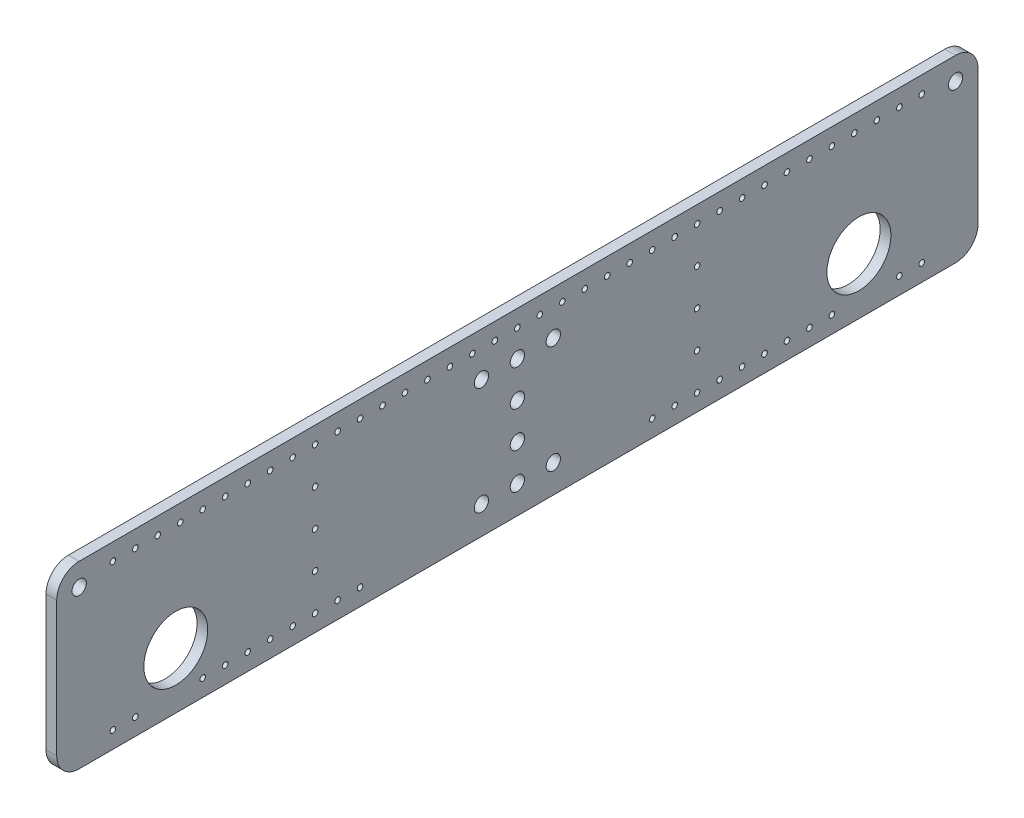
from build123d import *

# Parameters (mm, degrees)
SKETCH2_R           = 14.225
SKETCH2_R_2         = 3.18
SKETCH2_R_3         = 1.25
BOSS_EXTRUDE1_DEPTH = 4.7625


with BuildPart() as part:
    # Sketch2 → Boss-Extrude1 (new body)
    with BuildSketch(Plane(origin=(0, 0, 0), x_dir=(0, 0, -1), z_dir=(1, 0, 0))):
        with BuildLine():
            Line((-23.472321429, 28.668303571), (-23.472321429, -31.331696429))
            ThreePointArc((-23.472321429, -31.331696429), (-20.54338924, -38.40276424), (-13.472321429, -41.331696429))
            Line((-13.472321429, -41.331696429), (376.527678571, -41.331696429))
            ThreePointArc((376.527678571, -41.331696429), (383.598746383, -38.40276424), (386.527678571, -31.331696429))
            Line((386.527678571, -31.331696429), (386.527678571, 28.668303571))
            ThreePointArc((386.527678571, 28.668303571), (383.598746383, 35.739371383), (376.527678571, 38.668303571))
            Line((376.527678571, 38.668303571), (-13.472321429, 38.668303571))
            ThreePointArc((-13.472321429, 38.668303571), (-20.54338924, 35.739371383), (-23.472321429, 28.668303571))
        make_face()
        with Locations((29.527678571, -16.331696429)):
            Circle(SKETCH2_R, mode=Mode.SUBTRACT)
        with Locations((333.527678571, -16.331696429)):
            Circle(SKETCH2_R, mode=Mode.SUBTRACT)
        with Locations((181.527678571, -28.771696429)):
            Circle(SKETCH2_R_2, mode=Mode.SUBTRACT)
        with Locations((197.527678571, -28.771696429)):
            Circle(SKETCH2_R_2, mode=Mode.SUBTRACT)
        with Locations((197.527678571, 19.228303571)):
            Circle(SKETCH2_R_2, mode=Mode.SUBTRACT)
        with Locations((181.527678571, -12.771696429)):
            Circle(SKETCH2_R_2, mode=Mode.SUBTRACT)
        with Locations((181.527678571, 3.228303571)):
            Circle(SKETCH2_R_2, mode=Mode.SUBTRACT)
        with Locations((181.527678571, 19.228303571)):
            Circle(SKETCH2_R_2, mode=Mode.SUBTRACT)
        with Locations((165.527678571, -28.771696429)):
            Circle(SKETCH2_R_2, mode=Mode.SUBTRACT)
        with Locations((165.527678571, 19.228303571)):
            Circle(SKETCH2_R_2, mode=Mode.SUBTRACT)
        with Locations((1.527678571, 31.168303571)):
            Circle(SKETCH2_R_3, mode=Mode.SUBTRACT)
        with Locations((11.527678571, 31.168303571)):
            Circle(SKETCH2_R_3, mode=Mode.SUBTRACT)
        with Locations((21.527678571, 31.168303571)):
            Circle(SKETCH2_R_3, mode=Mode.SUBTRACT)
        with Locations((31.527678571, 31.168303571)):
            Circle(SKETCH2_R_3, mode=Mode.SUBTRACT)
        with Locations((41.527678571, 31.168303571)):
            Circle(SKETCH2_R_3, mode=Mode.SUBTRACT)
        with Locations((51.527678571, 31.168303571)):
            Circle(SKETCH2_R_3, mode=Mode.SUBTRACT)
        with Locations((61.527678571, 31.168303571)):
            Circle(SKETCH2_R_3, mode=Mode.SUBTRACT)
        with Locations((71.527678571, 31.168303571)):
            Circle(SKETCH2_R_3, mode=Mode.SUBTRACT)
        with Locations((81.527678571, 31.168303571)):
            Circle(SKETCH2_R_3, mode=Mode.SUBTRACT)
        with Locations((91.527678571, 31.168303571)):
            Circle(SKETCH2_R_3, mode=Mode.SUBTRACT)
        with Locations((101.527678571, 31.168303571)):
            Circle(SKETCH2_R_3, mode=Mode.SUBTRACT)
        with Locations((111.527678571, 31.168303571)):
            Circle(SKETCH2_R_3, mode=Mode.SUBTRACT)
        with Locations((121.527678571, 31.168303571)):
            Circle(SKETCH2_R_3, mode=Mode.SUBTRACT)
        with Locations((131.527678571, 31.168303571)):
            Circle(SKETCH2_R_3, mode=Mode.SUBTRACT)
        with Locations((141.527678571, 31.168303571)):
            Circle(SKETCH2_R_3, mode=Mode.SUBTRACT)
        with Locations((151.527678571, 31.168303571)):
            Circle(SKETCH2_R_3, mode=Mode.SUBTRACT)
        with Locations((161.527678571, 31.168303571)):
            Circle(SKETCH2_R_3, mode=Mode.SUBTRACT)
        with Locations((171.527678571, 31.168303571)):
            Circle(SKETCH2_R_3, mode=Mode.SUBTRACT)
        with Locations((181.527678571, 31.168303571)):
            Circle(SKETCH2_R_3, mode=Mode.SUBTRACT)
        with Locations((191.527678571, 31.168303571)):
            Circle(SKETCH2_R_3, mode=Mode.SUBTRACT)
        with Locations((201.527678571, 31.168303571)):
            Circle(SKETCH2_R_3, mode=Mode.SUBTRACT)
        with Locations((211.527678571, 31.168303571)):
            Circle(SKETCH2_R_3, mode=Mode.SUBTRACT)
        with Locations((221.527678571, 31.168303571)):
            Circle(SKETCH2_R_3, mode=Mode.SUBTRACT)
        with Locations((231.527678571, 31.168303571)):
            Circle(SKETCH2_R_3, mode=Mode.SUBTRACT)
        with Locations((241.527678571, 31.168303571)):
            Circle(SKETCH2_R_3, mode=Mode.SUBTRACT)
        with Locations((251.527678571, 31.168303571)):
            Circle(SKETCH2_R_3, mode=Mode.SUBTRACT)
        with Locations((261.527678571, 31.168303571)):
            Circle(SKETCH2_R_3, mode=Mode.SUBTRACT)
        with Locations((271.527678571, 31.168303571)):
            Circle(SKETCH2_R_3, mode=Mode.SUBTRACT)
        with Locations((281.527678571, 31.168303571)):
            Circle(SKETCH2_R_3, mode=Mode.SUBTRACT)
        with Locations((291.527678571, 31.168303571)):
            Circle(SKETCH2_R_3, mode=Mode.SUBTRACT)
        with Locations((301.527678571, 31.168303571)):
            Circle(SKETCH2_R_3, mode=Mode.SUBTRACT)
        with Locations((311.527678571, 31.168303571)):
            Circle(SKETCH2_R_3, mode=Mode.SUBTRACT)
        with Locations((321.527678571, 31.168303571)):
            Circle(SKETCH2_R_3, mode=Mode.SUBTRACT)
        with Locations((331.527678571, 31.168303571)):
            Circle(SKETCH2_R_3, mode=Mode.SUBTRACT)
        with Locations((341.527678571, 31.168303571)):
            Circle(SKETCH2_R_3, mode=Mode.SUBTRACT)
        with Locations((351.527678571, 31.168303571)):
            Circle(SKETCH2_R_3, mode=Mode.SUBTRACT)
        with Locations((361.527678571, 31.168303571)):
            Circle(SKETCH2_R_3, mode=Mode.SUBTRACT)
        with Locations((1.527678571, -33.831696429)):
            Circle(SKETCH2_R_3, mode=Mode.SUBTRACT)
        with Locations((11.527678571, -33.831696429)):
            Circle(SKETCH2_R_3, mode=Mode.SUBTRACT)
        with Locations((41.527678571, -33.831696429)):
            Circle(SKETCH2_R_3, mode=Mode.SUBTRACT)
        with Locations((51.527678571, -33.831696429)):
            Circle(SKETCH2_R_3, mode=Mode.SUBTRACT)
        with Locations((61.527678571, -33.831696429)):
            Circle(SKETCH2_R_3, mode=Mode.SUBTRACT)
        with Locations((71.527678571, -33.831696429)):
            Circle(SKETCH2_R_3, mode=Mode.SUBTRACT)
        with Locations((81.527678571, -33.831696429)):
            Circle(SKETCH2_R_3, mode=Mode.SUBTRACT)
        with Locations((91.527678571, -33.831696429)):
            Circle(SKETCH2_R_3, mode=Mode.SUBTRACT)
        with Locations((101.527678571, -33.831696429)):
            Circle(SKETCH2_R_3, mode=Mode.SUBTRACT)
        with Locations((111.527678571, -33.831696429)):
            Circle(SKETCH2_R_3, mode=Mode.SUBTRACT)
        with Locations((241.527678571, -33.831696429)):
            Circle(SKETCH2_R_3, mode=Mode.SUBTRACT)
        with Locations((251.527678571, -33.831696429)):
            Circle(SKETCH2_R_3, mode=Mode.SUBTRACT)
        with Locations((261.527678571, -33.831696429)):
            Circle(SKETCH2_R_3, mode=Mode.SUBTRACT)
        with Locations((271.527678571, -33.831696429)):
            Circle(SKETCH2_R_3, mode=Mode.SUBTRACT)
        with Locations((281.527678571, -33.831696429)):
            Circle(SKETCH2_R_3, mode=Mode.SUBTRACT)
        with Locations((291.527678571, -33.831696429)):
            Circle(SKETCH2_R_3, mode=Mode.SUBTRACT)
        with Locations((301.527678571, -33.831696429)):
            Circle(SKETCH2_R_3, mode=Mode.SUBTRACT)
        with Locations((311.527678571, -33.831696429)):
            Circle(SKETCH2_R_3, mode=Mode.SUBTRACT)
        with Locations((321.527678571, -33.831696429)):
            Circle(SKETCH2_R_3, mode=Mode.SUBTRACT)
        with Locations((351.527678571, -33.831696429)):
            Circle(SKETCH2_R_3, mode=Mode.SUBTRACT)
        with Locations((361.527678571, -33.831696429)):
            Circle(SKETCH2_R_3, mode=Mode.SUBTRACT)
        with Locations((-13.472321429, 28.668303571)):
            Circle(SKETCH2_R_2, mode=Mode.SUBTRACT)
        with Locations((376.527678571, 28.668303571)):
            Circle(SKETCH2_R_2, mode=Mode.SUBTRACT)
        with Locations((261.527678571, -17.581696429)):
            Circle(SKETCH2_R_3, mode=Mode.SUBTRACT)
        with Locations((261.527678571, -1.331696429)):
            Circle(SKETCH2_R_3, mode=Mode.SUBTRACT)
        with Locations((261.527678571, 14.918303571)):
            Circle(SKETCH2_R_3, mode=Mode.SUBTRACT)
        with Locations((91.527678571, -17.581696429)):
            Circle(SKETCH2_R_3, mode=Mode.SUBTRACT)
        with Locations((91.527678571, -1.331696429)):
            Circle(SKETCH2_R_3, mode=Mode.SUBTRACT)
        with Locations((91.527678571, 14.918303571)):
            Circle(SKETCH2_R_3, mode=Mode.SUBTRACT)
    extrude(amount=BOSS_EXTRUDE1_DEPTH)


solid = part.part
